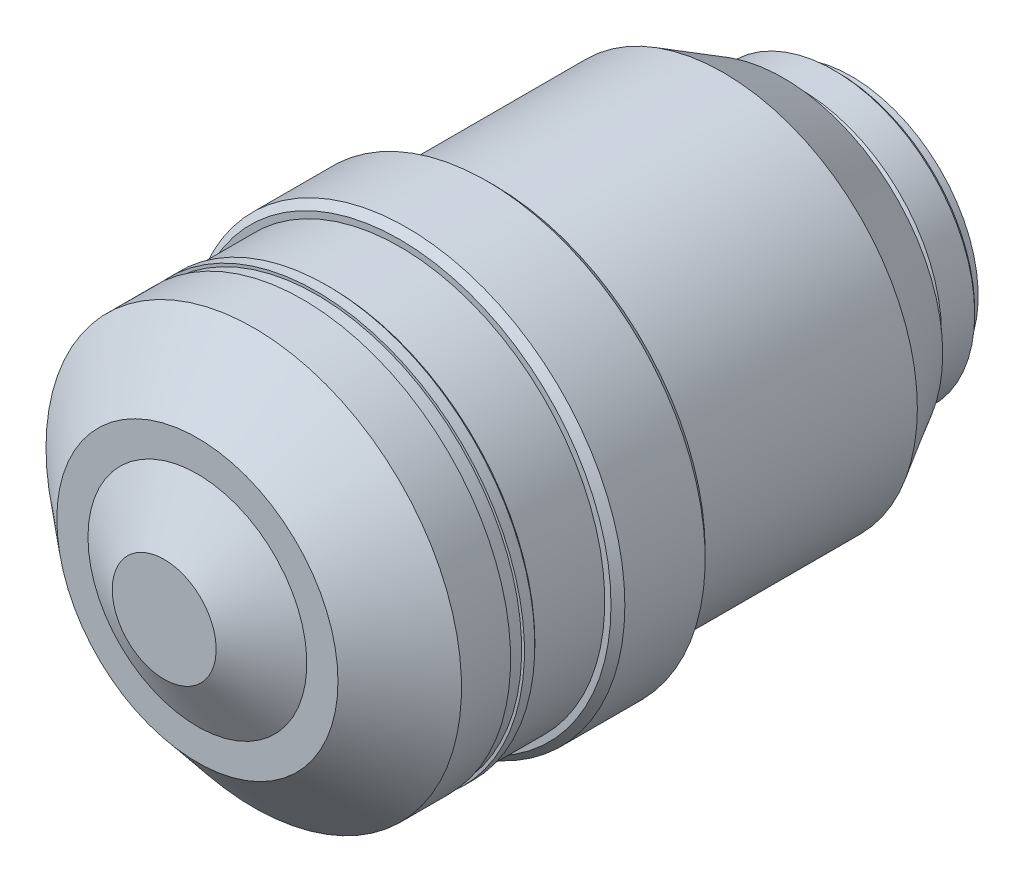
from build123d import *

# Parameters (mm, degrees)
CHAMFER1_SIZE      = 0.25
CHAMFER2_SIZE      = 0.5
SKETCH2_R          = 4.275
CUT_EXTRUDE1_DEPTH = 1


with BuildPart() as part:
    # Sketch1 → Revolve1 (revolve)
    with BuildSketch(Plane(origin=(0, 0, 0), x_dir=(1, 0, 0), z_dir=(0, 1, 0))):
        Polygon((0, 0.35), (-3.75, 0.35), (-7.9, 2.746003617), (-10.15, 2.746003617), (-15, 6.815636828), (-15, 10.36), (-14.8, 10.36), (-14.8, 11.36), (-15, 11.36), (-15, 12.36), (-14.8, 12.36), (-14.8, 17.36), (-15.75, 17.36), (-15.75, 24.16), (-14, 24.16), (-14, 40.729872981), (-11.5, 45.06), (-9.16, 45.06), (-9.16, 46.06), (-10.16, 46.06), (-10.16, 48.96), (-9.16, 48.96), (-9.16, 49.96), (0, 49.96), align=None)
    revolve(axis=Axis((0, 0, -49.96), (0, 0, 1)))

    # Chamfer1
    # the kernel refuses this chamfer: 0.25 mm, written as the material it takes off along each edge
    with BuildSketch(Plane(origin=(0, 0, -12.36), x_dir=(-1, 0, 0), z_dir=(0, 1, 0))) as chamfer1_piece_1_section:
        Polygon((15, CHAMFER1_SIZE), (15 - CHAMFER1_SIZE, 0), (15, 0), align=None)
    chamfer1_piece_1 = revolve(axis=Axis((0, 0, -12.36), (0, 0, 1)), mode=Mode.PRIVATE)
    chamfer1_piece_1 = chamfer1_piece_1 - Plane(origin=(0, 0, -12.216726666), x_dir=(-1, 0, 0), z_dir=(0, 0, -1)) * Cylinder(14.8, 60, mode=Mode.PRIVATE)
    add(chamfer1_piece_1, mode=Mode.SUBTRACT)
    with BuildSketch(Plane(origin=(0, 0, -48.96), x_dir=(-1, 0, 0), z_dir=(0, 1, 0))) as chamfer1_piece_2:
        Polygon((10.16, CHAMFER1_SIZE), (10.16 - CHAMFER1_SIZE, 0), (10.16, 0), align=None)
    revolve(axis=Axis((0, 0, -48.96), (0, 0, 1)), mode=Mode.SUBTRACT)
    with BuildSketch(Plane(origin=(0, 0, -46.06), x_dir=(-1, 0, 0), z_dir=(0, 1, 0))) as chamfer1_piece_3:
        Polygon((10.16 - CHAMFER1_SIZE, 0), (10.16, -CHAMFER1_SIZE), (10.16, 0), align=None)
    revolve(axis=Axis((0, 0, -46.06), (0, 0, 1)), mode=Mode.SUBTRACT)

    # Chamfer2
    chamfer2_edges = [part.edges().sort_by_distance(p)[0] for p in [
        (15.75, 0, -24.16),
        (15.75, 0, -17.36),
    ]]
    chamfer(chamfer2_edges, length=CHAMFER2_SIZE)

    # Sketch2 → Cut-Extrude1 (cut)
    with BuildSketch(Plane(origin=(0, 0, -49.96), x_dir=(-1, 0, 0), z_dir=(0, 0, -1))):
        Circle(SKETCH2_R)
    extrude(amount=-CUT_EXTRUDE1_DEPTH, mode=Mode.SUBTRACT)


solid = part.part
